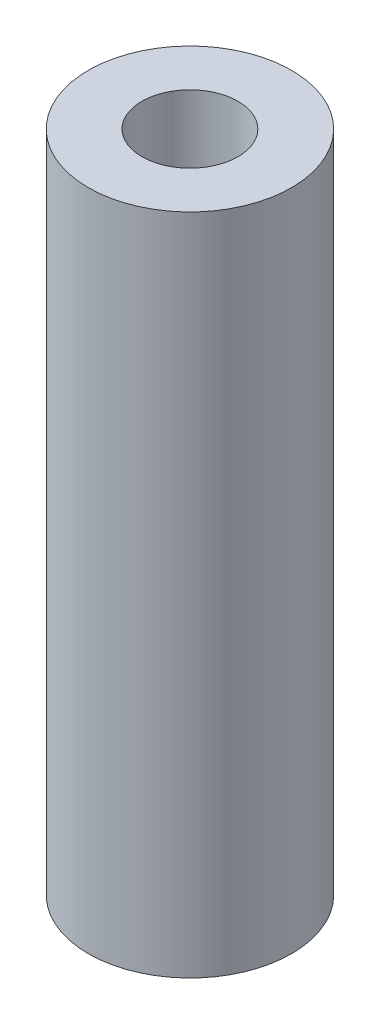
from build123d import *

# Parameters (mm, degrees)
SKETCH1_R           = 5.975
BOSS_EXTRUDE1_DEPTH = 39
SKETCH2_R           = 2.825
CUT_EXTRUDE1_DEPTH  = 9


with BuildPart() as part:
    # Sketch1 → Boss-Extrude1 (new body)
    with BuildSketch(Plane(origin=(0, 0, 0), x_dir=(1, 0, 0), z_dir=(0, 1, 0))):
        Circle(SKETCH1_R)
    extrude(amount=BOSS_EXTRUDE1_DEPTH)

    # Sketch2 → Cut-Extrude1 (cut)
    with BuildSketch(Plane(origin=(0, 39, 0), x_dir=(1, 0, 0), z_dir=(0, 1, 0))):
        Circle(SKETCH2_R)
    extrude(amount=-CUT_EXTRUDE1_DEPTH, mode=Mode.SUBTRACT)


solid = part.part
